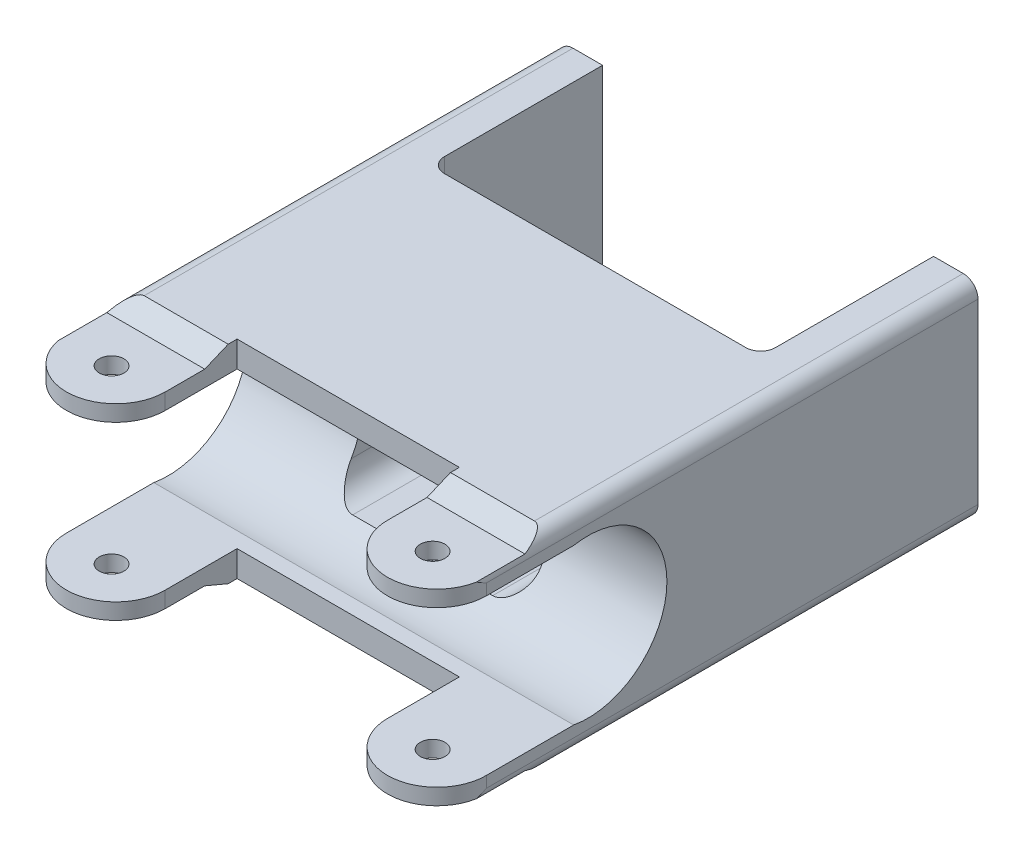
from build123d import *

# Parameters (mm, degrees)
SKETCH1_W               = 85
SKETCH1_H               = 85
SKETCH1_W_2             = 20
SKETCH1_H_2             = 25
BOSS_EXTRUDE1_DEPTH     = 42
CUT_EXTRUDE1_DEPTH      = 108.686284851
CUT_EXTRUDE2_DEPTH      = 122.642881801
CUT_EXTRUDE3_START      = -85
CUT_EXTRUDE3_DEPTH      = 85
SKETCH6_W               = 67
SKETCH6_H               = 42
CUT_EXTRUDE4_DEPTH      = 35
FILLET1_R               = 3
FILLET2_R               = 3
CUT_EXTRUDE6_DEPTH      = 107.514112815
CUT_EXTRUDE6_DEPTH_BACK = 107.514112815
M5_TAPPED_HOLE2_D       = 4.2
M5_TAPPED_HOLE2_DEPTH   = 8
M5_TAPPED_HOLE2_TIP     = 1.2618073
SKETCH17_R              = 2.5
CUT_EXTRUDE7_DEPTH      = 107.922102397


# Read off the part's stored shape, not the designer's step: Cut-Extrude3
with BuildPart() as part:
    # Sketch1 → Boss-Extrude1 (new body)
    with BuildSketch(Plane(origin=(0, 0, 0), x_dir=(1, 0, 0), z_dir=(0, 1, 0))):
        with Locations((-20.937727355, 33.710174471)):
            Rectangle(SKETCH1_W, SKETCH1_H)
        with Locations((-53.437727355, -21.289825529)):
            Rectangle(SKETCH1_W_2, SKETCH1_H_2)
        with Locations((11.562272645, -21.289825529)):
            Rectangle(SKETCH1_W_2, SKETCH1_H_2)
    extrude(amount=BOSS_EXTRUDE1_DEPTH)

    # Sketch2 → Cut-Extrude1 (cut, through all)
    with BuildSketch(Plane(origin=(0, 42, 0), x_dir=(1, 0, 0), z_dir=(0, 1, 0))):
        with BuildLine():
            Line((-63.437727355, -23.334516424), (-63.437727355, -33.789825529))
            Line((-63.437727355, -33.789825529), (-43.437727355, -33.789825529))
            Line((-43.437727355, -33.789825529), (-43.437727355, -23.334516424))
            ThreePointArc((-43.437727355, -23.334516424), (-53.437727355, -33.334516424), (-63.437727355, -23.334516424))
        make_face()
        with BuildLine():
            Line((1.562272645, -23.334516424), (1.562272645, -33.789825529))
            Line((1.562272645, -33.789825529), (21.562272645, -33.789825529))
            Line((21.562272645, -33.789825529), (21.562272645, -23.334516424))
            ThreePointArc((21.562272645, -23.334516424), (11.562272645, -33.334516424), (1.562272645, -23.334516424))
        make_face()
    extrude(amount=-CUT_EXTRUDE1_DEPTH, mode=Mode.SUBTRACT)

    # Sketch3 → Cut-Extrude2 (cut, through all)
    with BuildSketch(Plane.ZY.offset(63.437727355)):
        Polygon((33.334516424, 2), (15.334516424, 2), (10.589618013, 0), (33.334516424, 0), align=None)
        Polygon((15.334516424, 40), (10.589618013, 42), (33.334516424, 42), (33.334516424, 40), align=None)
    extrude(amount=-CUT_EXTRUDE2_DEPTH, mode=Mode.SUBTRACT)

    # Cut-Extrude3 outline → Cut-Extrude3 (cut)
    with BuildSketch(Plane.ZY.offset(63.437727355).offset(CUT_EXTRUDE3_START)):
        with BuildLine():
            Line((33.334516424, 5.260289026), (33.334516424, 36.739710974))
            Line((33.334516424, 36.739710974), (5.643342669, 36.739710974))
            ThreePointArc((5.643342669, 36.739710974), (-13.23093958, 21), (5.643342669, 5.260289026))
            Line((5.643342669, 5.260289026), (33.334516424, 5.260289026))
        make_face()
    extrude(amount=CUT_EXTRUDE3_DEPTH, mode=Mode.SUBTRACT)

    # Sketch6 → Cut-Extrude4 (cut)
    with BuildSketch(Plane(origin=(0, 0, -76.210174471), x_dir=(-1, 0, 0), z_dir=(0, 0, -1))):
        with Locations((20.937727355, 21)):
            Rectangle(SKETCH6_W, SKETCH6_H)
    extrude(amount=-CUT_EXTRUDE4_DEPTH, mode=Mode.SUBTRACT)

    # Fillet1
    # the kernel refuses this fillet: 3 mm, written as the material it takes off along each edge
    with BuildSketch(Plane(origin=(-63.437727355, 42, -94.210174471), x_dir=(1, 0, 0), z_dir=(0, 0, 1)), Plane(origin=(-63.437727355, 0, 28.589618013), x_dir=(1, 0, 0), z_dir=(0, 0, -1)), Plane(origin=(21.562272645, 42, -94.210174471), x_dir=(0, -1, 0), z_dir=(0, 0, 1)), Plane(origin=(21.562272645, 0, 28.589618013), x_dir=(0, 1, 0), z_dir=(0, 0, -1))) as fillet1_piece_1:
        with BuildLine():
            CenterArc((FILLET1_R, -FILLET1_R), FILLET1_R, 90, 90)
            Line((0, -FILLET1_R), (-FILLET1_R * 0.02, -FILLET1_R))
            Line((-FILLET1_R * 0.02, -FILLET1_R), (-FILLET1_R * 0.02, FILLET1_R * 0.02))
            Line((-FILLET1_R * 0.02, FILLET1_R * 0.02), (FILLET1_R, FILLET1_R * 0.02))
            Line((FILLET1_R, FILLET1_R * 0.02), (FILLET1_R, 0))
        make_face()
    extrude(amount=122.799792484, mode=Mode.SUBTRACT)

    # Fillet2
    fillet2_edges = [part.edges().sort_by_distance(p)[0] for p in [
        (12.562272645, 21, -41.210174471),
        (-54.437727355, 21, -41.210174471),
    ]]
    fillet(fillet2_edges, radius=FILLET2_R)

    # Sketch9 → Cut-Extrude6 (cut, two sides: drawn at the far end of the back side and taken through both)
    with BuildSketch(Plane(origin=(0, 0, -41.210174471), x_dir=(-1, 0, 0), z_dir=(0, 0, -1)).offset(-CUT_EXTRUDE6_DEPTH_BACK)):
        with BuildLine():
            Line((35.10328306, 7.804043613), (6.77217165, 7.804043613))
            ThreePointArc((6.77217165, 7.804043613), (3.236637744, 9.268509707), (1.77217165, 12.804043613))
            Line((1.77217165, 12.804043613), (1.77217165, 29.195956387))
            ThreePointArc((1.77217165, 29.195956387), (3.236637744, 32.731490293), (6.77217165, 34.195956387))
            Line((6.77217165, 34.195956387), (35.10328306, 34.195956387))
            ThreePointArc((35.10328306, 34.195956387), (38.638816966, 32.731490293), (40.10328306, 29.195956387))
            Line((40.10328306, 29.195956387), (40.10328306, 12.804043613))
            ThreePointArc((40.10328306, 12.804043613), (38.638816966, 9.268509707), (35.10328306, 7.804043613))
        make_face()
    extrude(amount=CUT_EXTRUDE6_DEPTH + CUT_EXTRUDE6_DEPTH_BACK, mode=Mode.SUBTRACT)

    # M5 Tapped Hole2
    with Locations(Plane(origin=(16.562272645, 29.5, -76.210174471), x_dir=(-1, 0, 0), z_dir=(0, 0, -1))):
        with Locations((0, 0), (0, -17), (75, -17), (75, 0)):
            Hole(M5_TAPPED_HOLE2_D / 2, depth=M5_TAPPED_HOLE2_DEPTH)
            with Locations((0, 0, -(M5_TAPPED_HOLE2_DEPTH + M5_TAPPED_HOLE2_TIP / 2))):  # 118° drill point
                Cone(0, M5_TAPPED_HOLE2_D / 2, M5_TAPPED_HOLE2_TIP, mode=Mode.SUBTRACT)

    # Sketch17 → Cut-Extrude7 (cut, through all)
    with BuildSketch(Plane(origin=(0, 40, 0), x_dir=(1, 0, 0), z_dir=(0, 1, 0))):
        with Locations(Location((-53.437727355, -24.203700837, 0), (0, 0, 270))):
            Circle(SKETCH17_R)
        with Locations(Location((11.562272645, -24.203700837, 0), (0, 0, 270))):
            Circle(SKETCH17_R)
    extrude(amount=-CUT_EXTRUDE7_DEPTH, mode=Mode.SUBTRACT)


solid = part.part
